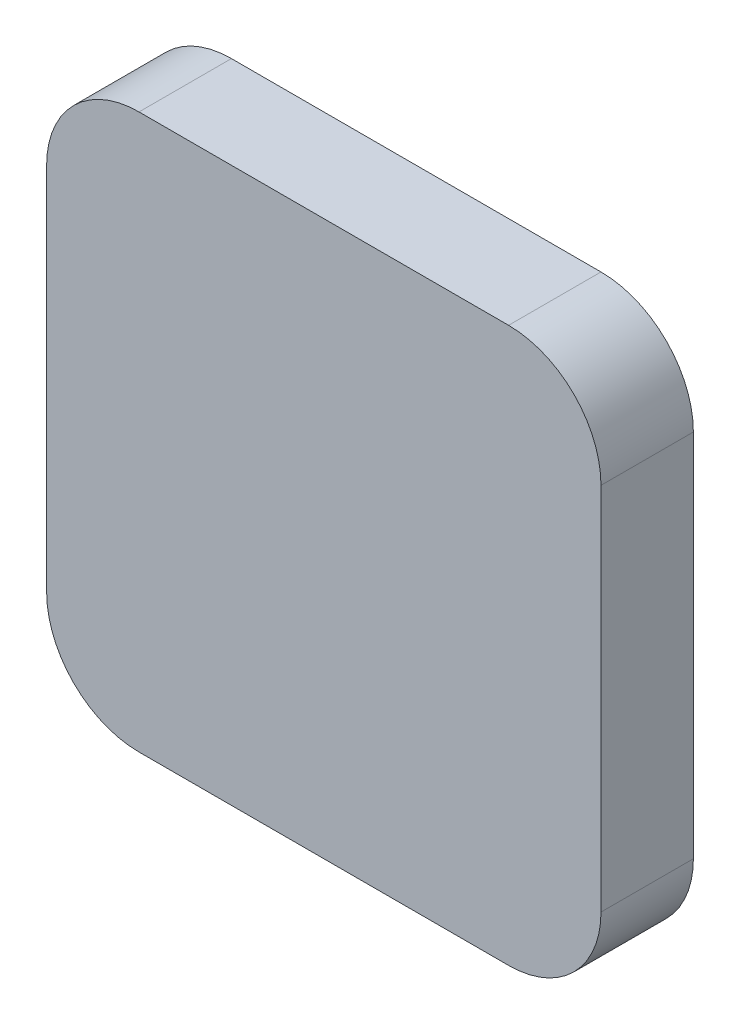
from build123d import *

# Parameters (mm, degrees)
ESBO_O1_W                = 12
ESBO_O1_H                = 12
RESSALTO_EXTRUS_O1_DEPTH = 2
FILETE1_R                = 2


with BuildPart() as part:
    # Esboço1 → Ressalto-extrusão1 (new body)
    with BuildSketch(Plane.XY):
        Rectangle(ESBO_O1_W, ESBO_O1_H)
    extrude(amount=RESSALTO_EXTRUS_O1_DEPTH)

    # Filete1
    filete1_edges = [part.edges().sort_by_distance(p)[0] for p in [
        (-6, 6, 1),
        (-6, -6, 1),
        (6, -6, 1),
        (6, 6, 1),
    ]]
    fillet(filete1_edges, radius=FILETE1_R)


solid = part.part
